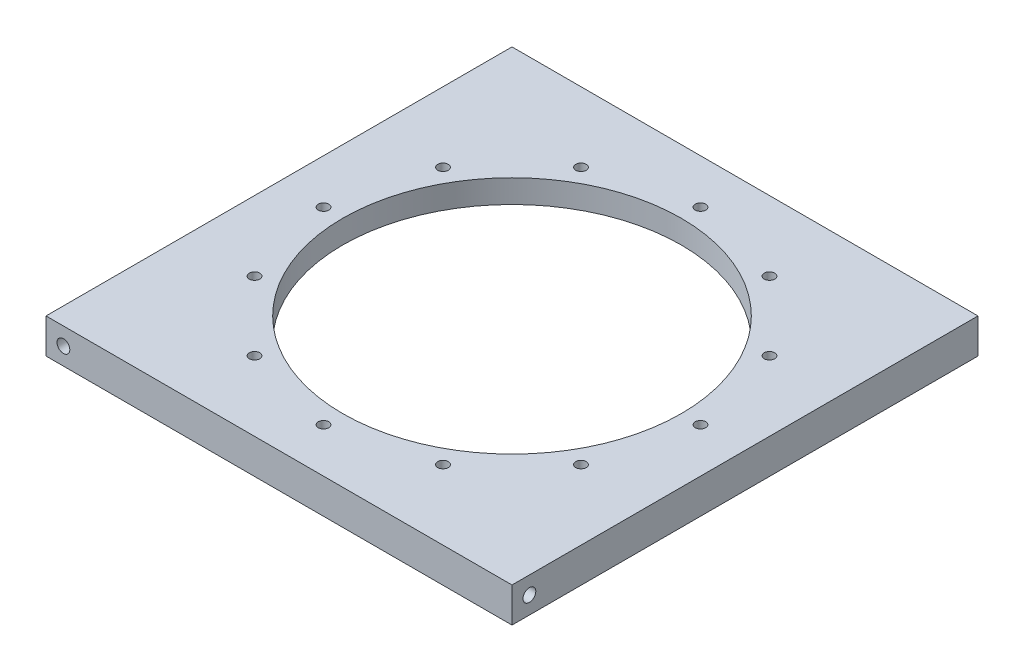
from build123d import *

# Parameters (mm, degrees)
SKETCH1_W           = 127.635
SKETCH1_H           = 127.635
BOSS_EXTRUDE1_DEPTH = 9.525
CUT_EXTRUDE1_DEPTH  = 9.525
SKETCH6_R           = 1.7526
F_6_32_HOLE1_DEPTH  = 6.35
SKETCH7_R           = 1.7526
F_6_32_HOLE2_DEPTH  = 6.35
SKETCH8_R           = 1.7526
F_6_32_HOLE3_DEPTH  = 6.35
SKETCH9_R           = 1.7526
F_6_32_HOLE4_DEPTH  = 6.35
SKETCH10_R          = 56.35625
CUT_EXTRUDE2_DEPTH  = 3.175
SKETCH11_R          = 1.4351
CUT_EXTRUDE3_DEPTH  = 181.754286464
CIRPATTERN1_COUNT   = 12


with BuildPart() as part:
    # Sketch1 → Boss-Extrude1 (new body)
    with BuildSketch(Plane(origin=(0, 0, 0), x_dir=(1, 0, 0), z_dir=(0, 1, 0))):
        with Locations((63.8175, 63.8175)):
            Rectangle(SKETCH1_W, SKETCH1_H)
    extrude(amount=BOSS_EXTRUDE1_DEPTH)

    # Sketch5 → Cut-Extrude1 (cut)
    with BuildSketch(Plane(origin=(0, 9.525, 0), x_dir=(1, 0, 0), z_dir=(0, 1, 0))):
        with BuildLine():
            ThreePointArc((63.8175, 110.1725), (17.4625, 63.8175), (63.8175, 17.4625))
            Line((63.8175, 17.4625), (63.8175, 110.1725))
        make_face()
        with BuildLine():
            Line((63.8175, 110.1725), (63.8175, 17.4625))
            ThreePointArc((63.8175, 17.4625), (96.595434842, 31.039565158), (110.1725, 63.8175))
            ThreePointArc((110.1725, 63.8175), (96.595434842, 96.595434842), (63.8175, 110.1725))
        make_face()
        with BuildLine():
            ThreePointArc((63.8175, 110.1725), (17.4625, 63.8175), (63.8175, 17.4625))
            Line((63.8175, 17.4625), (63.8175, 110.1725))
        make_face()
        with BuildLine():
            Line((63.8175, 110.1725), (63.8175, 17.4625))
            ThreePointArc((63.8175, 17.4625), (96.595434842, 31.039565158), (110.1725, 63.8175))
            ThreePointArc((110.1725, 63.8175), (96.595434842, 96.595434842), (63.8175, 110.1725))
        make_face()
    extrude(amount=-CUT_EXTRUDE1_DEPTH, mode=Mode.SUBTRACT)

    # Sketch6 → 6-32 hole1 (cut)
    with BuildSketch(Plane(origin=(127.635, 0, 0), x_dir=(0, 0, -1), z_dir=(1, 0, 0))):
        with Locations((4.7625, 4.7625)):
            Circle(SKETCH6_R)
    extrude(amount=-F_6_32_HOLE1_DEPTH, mode=Mode.SUBTRACT)

    # Sketch7 → 6-32 hole2 (cut)
    with BuildSketch(Plane(origin=(0, 0, -127.635), x_dir=(-1, 0, 0), z_dir=(0, 0, -1))):
        with Locations((-122.8725, 4.7625)):
            Circle(SKETCH7_R)
    extrude(amount=-F_6_32_HOLE2_DEPTH, mode=Mode.SUBTRACT)

    # Sketch8 → 6-32 hole3 (cut)
    with BuildSketch(Plane.ZY):
        with Locations((-122.8725, 4.7625)):
            Circle(SKETCH8_R)
    extrude(amount=-F_6_32_HOLE3_DEPTH, mode=Mode.SUBTRACT)

    # Sketch9 → 6-32 hole4 (cut)
    with BuildSketch(Plane.XY):
        with Locations((4.7625, 4.7625)):
            Circle(SKETCH9_R)
    extrude(amount=-F_6_32_HOLE4_DEPTH, mode=Mode.SUBTRACT)

    # Sketch10 → Cut-Extrude2 (cut)
    with BuildSketch(Plane.XZ):
        with Locations((63.8175, -63.8175)):
            Circle(SKETCH10_R)
    extrude(amount=-CUT_EXTRUDE2_DEPTH, mode=Mode.SUBTRACT)

    # Sketch11 → Cut-Extrude3 (cut, through all)
    with BuildSketch(Plane(origin=(0, 9.525, 0), x_dir=(1, 0, 0), z_dir=(0, 1, 0))):
        with Locations((63.8175, 115.443)):
            Circle(SKETCH11_R)
    cut_extrude3 = extrude(amount=-CUT_EXTRUDE3_DEPTH, mode=Mode.SUBTRACT)

    # CirPattern1: Cut-Extrude3 ×12 about axis
    cirpattern1_axis = Axis((63.8175, 9.525, -63.8175), (0, 1, 0))
    for i in range(1, CIRPATTERN1_COUNT):
        add(cut_extrude3.rotate(cirpattern1_axis, i * 360 / CIRPATTERN1_COUNT), mode=Mode.SUBTRACT)


solid = part.part
